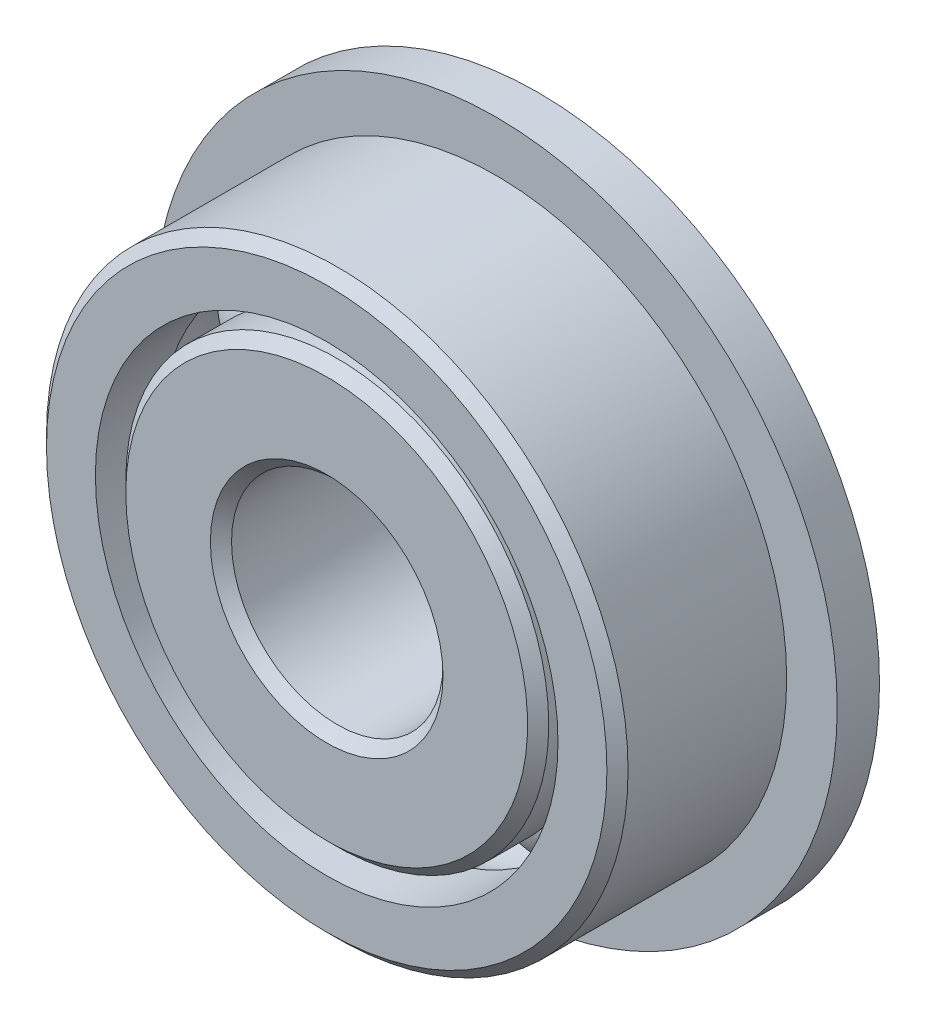
from build123d import *

# Parameters (mm, degrees)
SKETCH6_W         = 1.27
SKETCH6_H         = 3.3035875
CIRPATTERN1_COUNT = 8


with BuildPart() as part:
    # Sketch1 → Revolve1 (revolve)
    with BuildSketch(Plane(origin=(0, 0, 0), x_dir=(0, 0, -1), z_dir=(1, 0, 0))):
        with BuildLine():
            Line((2.8575, 8.73125), (-2.8575, 8.73125))
            Line((-2.8575, 8.73125), (-3.175, 8.41375))
            Line((-3.175, 8.41375), (-3.175, 6.9453125))
            Line((-3.175, 6.9453125), (-1.23924179, 6.9453125))
            ThreePointArc((-1.23924179, 6.9453125), (0, 7.540625), (1.23924179, 6.9453125))
            Line((1.23924179, 6.9453125), (3.175, 6.9453125))
            Line((3.175, 6.9453125), (3.175, 8.41375))
            Line((3.175, 8.41375), (2.8575, 8.73125))
        make_face()
    revolve(axis=Axis((0, 0, 3.175), (0, 0, -1)))

    # Sketch6 → Revolve6 (revolve)
    with BuildSketch(Plane(origin=(0, 0, 0), x_dir=(0, 0, -1), z_dir=(1, 0, 0))):
        with Locations((2.54, 8.59710625)):
            Rectangle(SKETCH6_W, SKETCH6_H)
    revolve(axis=Axis((0, 0, -3.175), (0, 0, 1)))


with BuildPart() as body_2:
    # Sketch3 → Revolve3 (revolve)
    with BuildSketch(Plane(origin=(0, 0, 0), x_dir=(0, 0, -1), z_dir=(1, 0, 0))):
        with BuildLine():
            Line((-3.175, 3.4925), (-3.175, 6.0325))
            Line((-3.175, 6.0325), (-2.8575, 6.35))
            Line((-2.8575, 6.35), (-1.537090266, 6.35))
            ThreePointArc((-1.537090266, 6.35), (0, 4.365625), (1.537090266, 6.35))
            Line((1.537090266, 6.35), (4.4577, 6.35))
            Line((4.4577, 6.35), (4.7752, 6.0325))
            Line((4.7752, 6.0325), (4.7752, 3.4925))
            Line((4.7752, 3.4925), (4.4577, 3.175))
            Line((4.4577, 3.175), (-2.8575, 3.175))
            Line((-2.8575, 3.175), (-3.175, 3.4925))
        make_face()
    revolve(axis=Axis((0, 0, 3.175), (0, 0, -1)))


with BuildPart() as body_3:
    # Sketch4 → Revolve4 (revolve)
    with BuildSketch(Plane(origin=(0, 0, 0), x_dir=(0, 0, -1), z_dir=(1, 0, 0))):
        with BuildLine():
            Line((-1.5875, 5.953125), (1.5875, 5.953125))
            ThreePointArc((1.5875, 5.953125), (0, 7.540625), (-1.5875, 5.953125))
        make_face()
    revolve(axis=Axis((0, 5.953125, 1.5875), (0, 0, -1)))


with BuildPart() as cirpattern1_1:
    # CirPattern1: pattern copy
    add(body_3.part.rotate(Axis((0, 0, -3.175), (0, 0, 1)), 1 * 360 / CIRPATTERN1_COUNT))


with BuildPart() as cirpattern1_2:
    # CirPattern1: pattern copy
    add(body_3.part.rotate(Axis((0, 0, -3.175), (0, 0, 1)), 2 * 360 / CIRPATTERN1_COUNT))


with BuildPart() as cirpattern1_3:
    # CirPattern1: pattern copy
    add(body_3.part.rotate(Axis((0, 0, -3.175), (0, 0, 1)), 3 * 360 / CIRPATTERN1_COUNT))


with BuildPart() as cirpattern1_4:
    # CirPattern1: pattern copy
    add(body_3.part.rotate(Axis((0, 0, -3.175), (0, 0, 1)), 4 * 360 / CIRPATTERN1_COUNT))


with BuildPart() as cirpattern1_5:
    # CirPattern1: pattern copy
    add(body_3.part.rotate(Axis((0, 0, -3.175), (0, 0, 1)), 5 * 360 / CIRPATTERN1_COUNT))


with BuildPart() as cirpattern1_6:
    # CirPattern1: pattern copy
    add(body_3.part.rotate(Axis((0, 0, -3.175), (0, 0, 1)), 6 * 360 / CIRPATTERN1_COUNT))


with BuildPart() as cirpattern1_7:
    # CirPattern1: pattern copy
    add(body_3.part.rotate(Axis((0, 0, -3.175), (0, 0, 1)), 7 * 360 / CIRPATTERN1_COUNT))


solid = Compound([part.part, body_2.part, body_3.part, cirpattern1_1.part, cirpattern1_2.part, cirpattern1_3.part, cirpattern1_4.part, cirpattern1_5.part, cirpattern1_6.part, cirpattern1_7.part])
